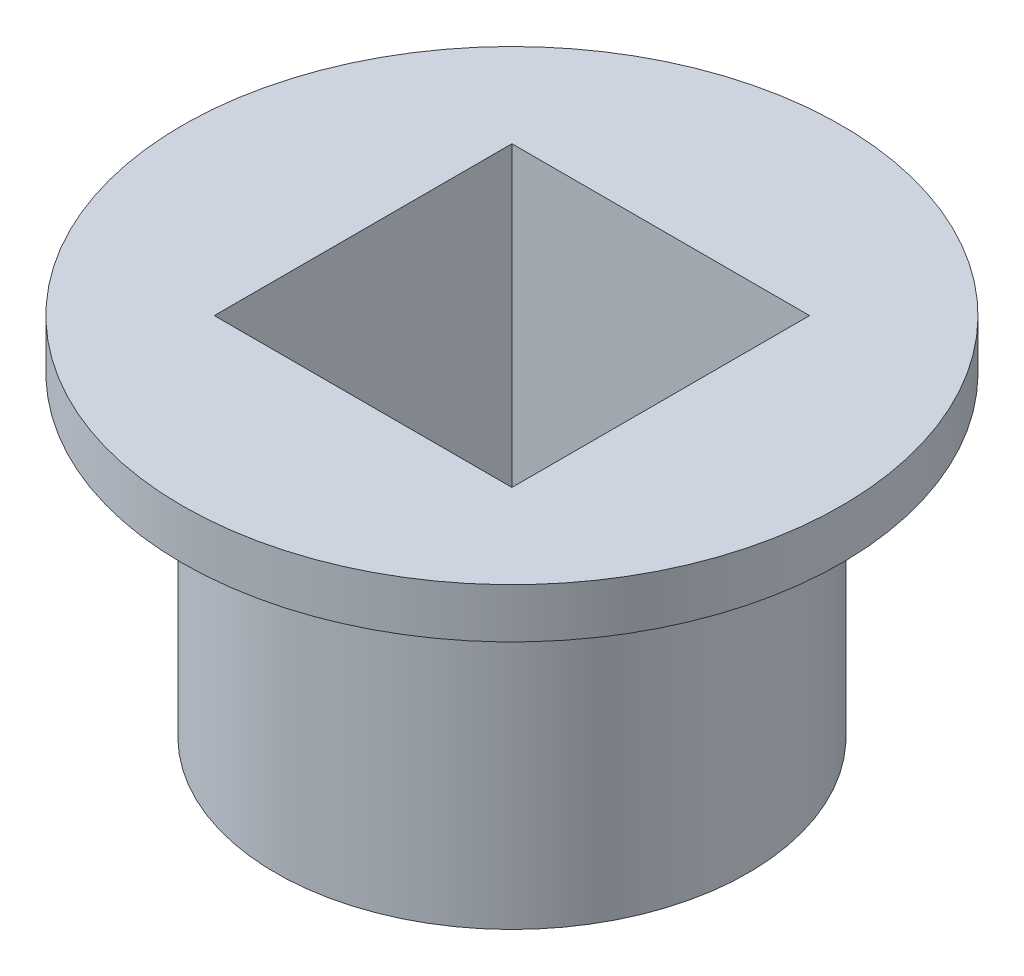
from build123d import *

# Parameters (mm, degrees)
SKETCH1_R           = 9.525
SKETCH1_W           = 12
SKETCH1_H           = 12
BOSS_EXTRUDE1_DEPTH = 12.70000008
BOSS_EXTRUDE3_START = -2
SKETCH2_R           = 13.2875
SKETCH2_R_2         = 9.525
BOSS_EXTRUDE3_DEPTH = 2
BOSS_EXTRUDE4_START = 2
SKETCH3_R           = 9.525
SKETCH3_R_2         = 4.5
BOSS_EXTRUDE4_DEPTH = 2


with BuildPart() as part:
    # Sketch1 → Boss-Extrude1 (new body)
    with BuildSketch(Plane(origin=(0, 0, 0), x_dir=(1, 0, 0), z_dir=(0, 1, 0))):
        Circle(SKETCH1_R)
        Rectangle(SKETCH1_W, SKETCH1_H, mode=Mode.SUBTRACT)
    extrude(amount=BOSS_EXTRUDE1_DEPTH)

    # Sketch2 → Boss-Extrude3 (add)
    with BuildSketch(Plane(origin=(0, 12.70000008, 0), x_dir=(1, 0, 0), z_dir=(0, 1, 0)).offset(BOSS_EXTRUDE3_START)):
        Circle(SKETCH2_R)
        Circle(SKETCH2_R_2, mode=Mode.SUBTRACT)
    extrude(amount=BOSS_EXTRUDE3_DEPTH)

    # Sketch3 → Boss-Extrude4 (add)
    with BuildSketch(Plane.XZ.offset(BOSS_EXTRUDE4_START)):
        Circle(SKETCH3_R)
        Circle(SKETCH3_R_2, mode=Mode.SUBTRACT)
    extrude(amount=-BOSS_EXTRUDE4_DEPTH)


solid = part.part
